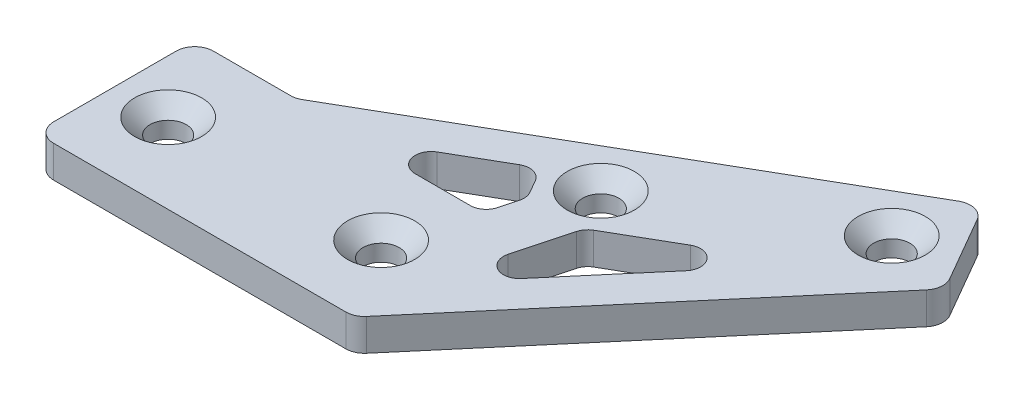
from build123d import *

# Parameters (mm, degrees)
SKETCH_2_R                   = 1.6
EXTRUDE_1_DEPTH              = 1.5
CUT_EXTRUDE_1_DEPTH          = 3
FILLET_1_R                   = 1
FILLET_2_R                   = 1.75
HOLE_WIZARD_M3_1_D           = 3.4
HOLE_WIZARD_M3_1_DEPTH       = 18.978536948
HOLE_WIZARD_M3_1_CSINK_D     = 6.3
HOLE_WIZARD_M3_1_CSINK_ANGLE = 90
HOLE_WIZARD_M3_1_TIP         = 1.021463052
MOVE_START                   = -1.5
MOVE_FACE_1_DEPTH            = 3


# Read off the part's stored shape, not the designer's step: 面の移動1
with BuildPart() as part:
    # ｽｹｯﾁ2 → ﾎﾞｽ - 押し出し1 (new, symmetric)
    with BuildSketch(Plane(origin=(0, 0, 0), x_dir=(1, 0, 0), z_dir=(0, 1, 0))):
        Polygon((24.47, 8.660254038), (9.47, 0), (0, 0), (0, -15), (30, -15), (55.450762114, 15), (50.450762114, 23.660254038), align=None)
        with Locations(Location((48.620635095, 16.830127019, 0), (0, 0, 270))):
            Circle(SKETCH_2_R, mode=Mode.SUBTRACT)
        with Locations(Location((25, -7.5, 0), (0, 0, 270))):
            Circle(SKETCH_2_R, mode=Mode.SUBTRACT)
        with Locations(Location((31.300127019, 6.830127019, 0), (0, 0, 270))):
            Circle(SKETCH_2_R, mode=Mode.SUBTRACT)
        with Locations(Location((5, -7.5, 0), (0, 0, 270))):
            Circle(SKETCH_2_R, mode=Mode.SUBTRACT)
    extrude(amount=EXTRUDE_1_DEPTH, both=True)

    # ｽｹｯﾁ3 → ｶｯﾄ - 押し出し1 (cut)
    with BuildSketch(Plane(origin=(0, 1.5, 0), x_dir=(1, 0, 0), z_dir=(0, 1, 0))):
        Polygon((26.47, 5.196152423), (17.47, 0), (27.140628594, 0), (27.879009742, 2.755675961), align=None)
        Polygon((33.352285677, 0), (37.479868618, 0), (45.169472556, 9.064094706), (34.062793268, 2.651650429), align=None)
        Polygon((31.44676478, -7.111500799), (37.479868618, 0), (33.352285677, 0), align=None)
    extrude(amount=-CUT_EXTRUDE_1_DEPTH, mode=Mode.SUBTRACT)

    # ﾌｨﾚｯﾄ1
    fillet_1_edges = [part.edges().sort_by_distance(p)[0] for p in [
        (27.879009742, 0, -2.755675961),
        (27.140628594, 0, 0),
        (17.47, 0, 0),
        (26.47, 0, -5.196152423),
        (34.062793268, 0, -2.651650429),
        (45.169472556, 0, -9.064094706),
        (31.44676478, 0, 7.111500799),
    ]]
    fillet(fillet_1_edges, radius=FILLET_1_R)

    # ﾌｨﾚｯﾄ2
    fillet_2_edges = [part.edges().sort_by_distance(p)[0] for p in [
        (50.450762114, 0, -23.660254038),
        (55.450762114, 0, -15),
        (30, 0, 15),
        (0, 0, 15),
        (0, 0, 0),
        (9.47, 0, 0),
    ]]
    fillet(fillet_2_edges, radius=FILLET_2_R)

    # M3 丸皿ねじ用皿穴1
    with Locations(Plane(origin=(5, 1.5, 7.5), x_dir=(0, 0, 1), z_dir=(0, 1, 0))):
        with Locations((0, 0), (0, 20), (-14.330127019, 26.300127019), (-24.330127019, 43.620635095)):
            CounterSinkHole(HOLE_WIZARD_M3_1_D / 2, HOLE_WIZARD_M3_1_CSINK_D / 2, depth=HOLE_WIZARD_M3_1_DEPTH, counter_sink_angle=HOLE_WIZARD_M3_1_CSINK_ANGLE)
            with Locations((0, 0, -(HOLE_WIZARD_M3_1_DEPTH + HOLE_WIZARD_M3_1_TIP / 2))):  # 118° drill point
                Cone(0, HOLE_WIZARD_M3_1_D / 2, HOLE_WIZARD_M3_1_TIP, mode=Mode.SUBTRACT)

    # Move Face 1 outline → Move Face 1 (cut)
    # profile 1 of 2: a face of its own
    with BuildSketch(Plane(origin=(0, 0, 0), x_dir=(1, 0, 0), z_dir=(0, 1, 0)).offset(MOVE_START)):
        with BuildLine():
            Line((39.92911769, 6.615924683), (34.171512735, 3.291769913))
            ThreePointArc((34.171512735, 3.291769913), (33.731482725, 2.90587395), (33.472623996, 2.380960375))
            Line((33.472623996, 2.380960375), (32.116497814, -2.680171439))
            ThreePointArc((32.116497814, -2.680171439), (32.869167953, -4.39703828), (34.709221416, -4.038782306))
            Line((34.709221416, -4.038782306), (41.822952552, 4.346504278))
            ThreePointArc((41.822952552, 4.346504278), (41.830787659, 6.27795696), (39.92911769, 6.615924683))
        make_face()
        with BuildLine():
            ThreePointArc((33.955586909, 2.251550852), (34.128159395, 2.601493236), (34.421512735, 2.858757211))
            Line((34.421512735, 2.858757211), (40.17911769, 6.182911981))
            ThreePointArc((40.17911769, 6.182911981), (41.44689767, 5.957600166), (41.441674265, 4.669965044))
            Line((41.441674265, 4.669965044), (34.327943128, -3.71532154))
            ThreePointArc((34.327943128, -3.71532154), (33.10124082, -3.954158856), (32.599460727, -2.809580962))
            Line((32.599460727, -2.809580962), (33.955586909, 2.251550852))
        make_face(mode=Mode.SUBTRACT)
    # profile 2 of 2: a face of its own
    with BuildSketch(Plane(origin=(0, 0, 0), x_dir=(1, 0, 0), z_dir=(0, 1, 0)).offset(MOVE_START)):
        with BuildLine():
            Line((27.822190346, 0.611771432), (28.254766297, 2.226166861))
            ThreePointArc((28.254766297, 2.226166861), (28.293044849, 2.810184717), (28.104915663, 3.364395428))
            Line((28.104915663, 3.364395428), (27.403012702, 4.580127019))
            ThreePointArc((27.403012702, 4.580127019), (26.492203164, 5.279015758), (25.353974596, 5.129165125))
            Line((25.353974596, 5.129165125), (20.452050808, 2.299038106))
            ThreePointArc((20.452050808, 2.299038106), (19.753162068, 0.611771432), (21.202050808, -0.5))
            Line((21.202050808, -0.5), (26.373301606, -0.5))
            ThreePointArc((26.373301606, -0.5), (27.286443749, -0.19003001), (27.822190346, 0.611771432))
        make_face()
        with BuildLine():
            Line((26.373301606, 0), (21.202050808, 0))
            ThreePointArc((21.202050808, 0), (20.236124981, 0.741180955), (20.702050808, 1.866025404))
            Line((20.702050808, 1.866025404), (25.603974596, 4.696152423))
            ThreePointArc((25.603974596, 4.696152423), (26.362793641, 4.796052845), (26.97, 4.330127019))
            Line((26.97, 4.330127019), (27.671902961, 3.114395428))
            ThreePointArc((27.671902961, 3.114395428), (27.797322419, 2.74492162), (27.771803384, 2.355576383))
            Line((27.771803384, 2.355576383), (27.339227432, 0.741180955))
            ThreePointArc((27.339227432, 0.741180955), (26.982063035, 0.20664666), (26.373301606, 0))
        make_face(mode=Mode.SUBTRACT)
    extrude(amount=MOVE_FACE_1_DEPTH, mode=Mode.SUBTRACT)


solid = part.part
